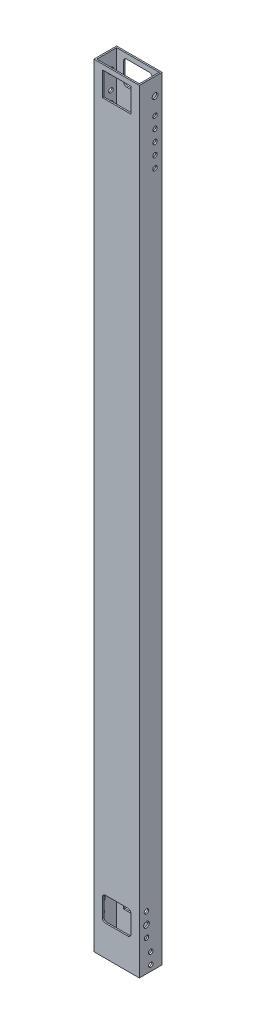
from build123d import *

# Parameters (mm, degrees)
SKETCH1_W               = 50.8
SKETCH1_H               = 863.6
BOSS_EXTRUDE1_DEPTH     = 12.7
SHELL1_T                = -1.5875
CUT_EXTRUDE1_DEPTH      = 433.73281595
CUT_EXTRUDE1_DEPTH_BACK = 433.73281595
SKETCH3_R               = 2.4892
CUT_EXTRUDE2_DEPTH      = 433.73281595
CUT_EXTRUDE2_DEPTH_BACK = 433.73281595
SKETCH4_R               = 3.175
SKETCH4_R_2             = 2.4892
CUT_EXTRUDE3_DEPTH      = 433.73281595
CUT_EXTRUDE3_DEPTH_BACK = 433.73281595
SKETCH5_W               = 31.75
SKETCH5_H               = 26.9875
FILLET1_R               = 3.175
CUT_EXTRUDE4_DEPTH      = 433.73281595
CUT_EXTRUDE4_DEPTH_BACK = 433.73281595
SKETCH6_R               = 3.175
CUT_EXTRUDE5_DEPTH      = 433.73281595
CUT_EXTRUDE5_DEPTH_BACK = 433.73281595
SKETCH7_W               = 31.75
SKETCH7_H               = 26.9875
FILLET2_R               = 3.175
CUT_EXTRUDE6_DEPTH      = 433.73281595
CUT_EXTRUDE6_DEPTH_BACK = 433.73281595
SKETCH8_R               = 2.4892


with BuildPart() as part:
    # Sketch1 → Boss-Extrude1 (new, symmetric)
    with BuildSketch(Plane.XY):
        Rectangle(SKETCH1_W, SKETCH1_H)
    extrude(amount=BOSS_EXTRUDE1_DEPTH, both=True)

    # Shell1
    shell1_openings = [part.faces().sort_by_distance(p)[0] for p in [
        (0, -431.8, 0),
        (0, 431.8, 0),
    ]]
    offset(amount=SHELL1_T, openings=shell1_openings, kind=Kind.INTERSECTION)

    # Sketch3 → Cut-Extrude1 (cut, two sides: drawn at the far end of the back side and taken through both)
    with BuildSketch(Plane(origin=(0, 0, 0), x_dir=(0, 0, -1), z_dir=(1, 0, 0)).offset(-CUT_EXTRUDE1_DEPTH_BACK)):
        with Locations((0, -425.45)):
            Circle(SKETCH3_R)
        with Locations((0, -412.75)):
            Circle(SKETCH3_R)
    extrude(amount=CUT_EXTRUDE1_DEPTH + CUT_EXTRUDE1_DEPTH_BACK, mode=Mode.SUBTRACT)

    # Sketch4 → Cut-Extrude2 (cut, two sides: drawn at the far end of the back side and taken through both)
    with BuildSketch(Plane(origin=(0, 0, 0), x_dir=(0, 0, -1), z_dir=(1, 0, 0)).offset(-CUT_EXTRUDE2_DEPTH_BACK)):
        with Locations((-4.7625, -384.175)):
            Circle(SKETCH4_R)
        with Locations((-4.7625, -371.475)):
            Circle(SKETCH4_R_2)
        with Locations((-4.7625, -396.875)):
            Circle(SKETCH4_R_2)
    extrude(amount=CUT_EXTRUDE2_DEPTH + CUT_EXTRUDE2_DEPTH_BACK, mode=Mode.SUBTRACT)

    # Sketch5 → Cut-Extrude3 (cut, two sides: drawn at the far end of the back side and taken through both)
    with BuildSketch(Plane.XY.offset(-CUT_EXTRUDE3_DEPTH_BACK)):
        with Locations((0, -384.175)):
            Rectangle(SKETCH5_W, SKETCH5_H)
    extrude(amount=CUT_EXTRUDE3_DEPTH + CUT_EXTRUDE3_DEPTH_BACK, mode=Mode.SUBTRACT)

    # Fillet1
    fillet1_edges = [part.edges().sort_by_distance(p)[0] for p in [
        (-15.875, -397.66875, 11.90625),
        (15.875, -397.66875, 11.90625),
        (-15.875, -370.68125, 11.90625),
        (15.875, -370.68125, 11.90625),
    ]]
    fillet(fillet1_edges, radius=FILLET1_R)

    # Sketch6 → Cut-Extrude4 (cut, two sides: drawn at the far end of the back side and taken through both)
    with BuildSketch(Plane(origin=(0, 0, 0), x_dir=(0, 0, -1), z_dir=(1, 0, 0)).offset(-CUT_EXTRUDE4_DEPTH_BACK)):
        with Locations((4.7625, 412.75)):
            Circle(SKETCH6_R)
    extrude(amount=CUT_EXTRUDE4_DEPTH + CUT_EXTRUDE4_DEPTH_BACK, mode=Mode.SUBTRACT)

    # Sketch7 → Cut-Extrude5 (cut, two sides: drawn at the far end of the back side and taken through both)
    with BuildSketch(Plane.XY.offset(-CUT_EXTRUDE5_DEPTH_BACK)):
        with Locations((0, 412.75)):
            Rectangle(SKETCH7_W, SKETCH7_H)
    extrude(amount=CUT_EXTRUDE5_DEPTH + CUT_EXTRUDE5_DEPTH_BACK, mode=Mode.SUBTRACT)

    # Fillet2
    fillet2_edges = [part.edges().sort_by_distance(p)[0] for p in [
        (15.875, 399.25625, -11.90625),
        (-15.875, 399.25625, -11.90625),
        (-15.875, 426.24375, -11.90625),
        (15.875, 426.24375, -11.90625),
    ]]
    fillet(fillet2_edges, radius=FILLET2_R)

    # Sketch8 → Cut-Extrude6 (cut, two sides: drawn at the far end of the back side and taken through both)
    with BuildSketch(Plane(origin=(0, 0, 0), x_dir=(0, 0, -1), z_dir=(1, 0, 0)).offset(-CUT_EXTRUDE6_DEPTH_BACK)):
        with Locations((4.7625, 393.7)):
            Circle(SKETCH8_R)
        with Locations((4.7625, 381)):
            Circle(SKETCH8_R)
        with Locations((4.7625, 368.3)):
            Circle(SKETCH8_R)
        with Locations((4.7625, 355.6)):
            Circle(SKETCH8_R)
        with Locations((4.7625, 342.9)):
            Circle(SKETCH8_R)
    extrude(amount=CUT_EXTRUDE6_DEPTH + CUT_EXTRUDE6_DEPTH_BACK, mode=Mode.SUBTRACT)


solid = part.part
